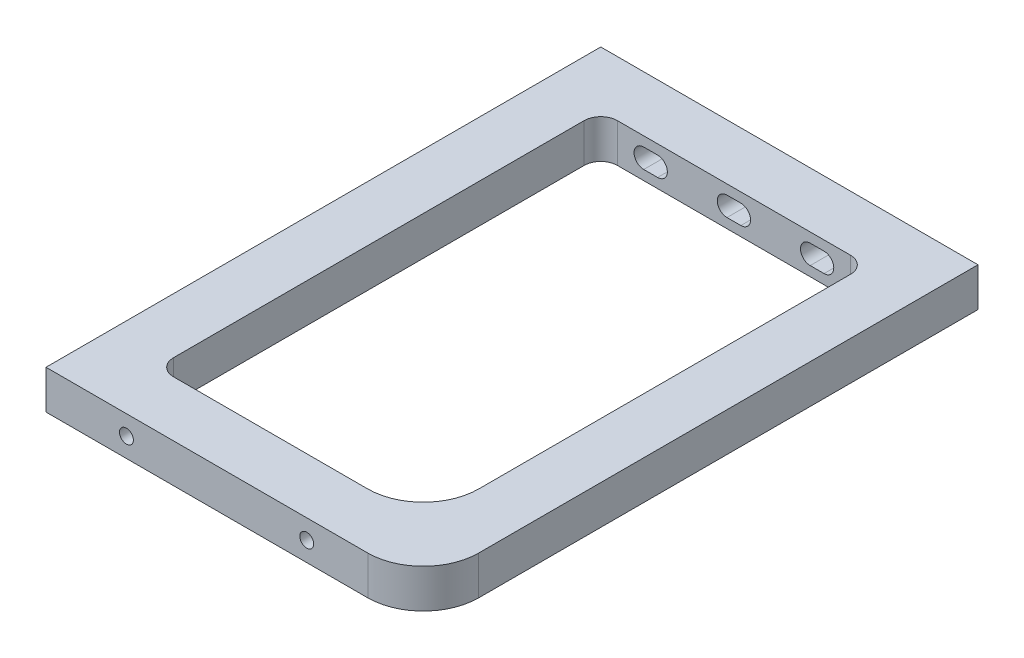
from build123d import *

# Parameters (mm, degrees)
BOSS_EXTRUDE1_DEPTH       = 200
CUT_EXTRUDE1_DEPTH        = 250.198715888
F_6_0MM_DOWEL_SLOT1_DEPTH = 20
M6X1_0_TAPPED_HOLE1_D     = 5
M6X1_0_TAPPED_HOLE1_DEPTH = 21.497848452
M6X1_0_TAPPED_HOLE1_TIP   = 1.502151548
FILLET1_R                 = 6
FILLET2_R                 = 20


# Read off the part's stored shape, not the designer's step: Ø6.0mm Dowel Slot1
with BuildPart() as part:
    # Sketch1 → Boss-Extrude1 (new body)
    with BuildSketch(Plane.XY):
        Polygon((-21, 207), (-148, 207), (-148, 197.5), (-148, 193), (-24, 193), (-12, 193), (-12, 207), align=None)
    extrude(amount=BOSS_EXTRUDE1_DEPTH)

    # Sketch3 → Cut-Extrude1 (cut, through all)
    with BuildSketch(Plane(origin=(0, 207, 0), x_dir=(1, 0, 0), z_dir=(0, 1, 0))):
        Polygon((-128, -20), (-128, -30), (-128, -108), (-128, -180), (-118, -180), (-54, -180), (-32, -180), (-32, -20), align=None)
    extrude(amount=-CUT_EXTRUDE1_DEPTH, mode=Mode.SUBTRACT)

    # Ø6.0mm Dowel Slot1 outline → Ø6.0mm Dowel Slot1 (cut)
    with BuildSketch(Plane.XY):
        with BuildLine():
            Line((-52.5, 196.5), (-47.5, 196.5))
            ThreePointArc((-47.5, 196.5), (-44, 200), (-47.5, 203.5))
            Line((-47.5, 203.5), (-52.5, 203.5))
            ThreePointArc((-52.5, 203.5), (-56, 200), (-52.5, 196.5))
        make_face()
        with BuildLine():
            ThreePointArc((-77.5, 196.5), (-74, 200), (-77.5, 203.5))
            Line((-77.5, 203.5), (-82.5, 203.5))
            ThreePointArc((-82.5, 203.5), (-86, 200), (-82.5, 196.5))
            Line((-82.5, 196.5), (-77.5, 196.5))
        make_face()
        with BuildLine():
            ThreePointArc((-107.5, 196.5), (-104, 200), (-107.5, 203.5))
            Line((-107.5, 203.5), (-112.5, 203.5))
            ThreePointArc((-112.5, 203.5), (-116, 200), (-112.5, 196.5))
            Line((-112.5, 196.5), (-107.5, 196.5))
        make_face()
    extrude(amount=F_6_0MM_DOWEL_SLOT1_DEPTH, mode=Mode.SUBTRACT)

    # M6x1.0 Tapped Hole1
    with Locations(Plane.XY.offset(200)):
        with Locations((-119, 200), (-54, 200)):
            Hole(M6X1_0_TAPPED_HOLE1_D / 2, depth=M6X1_0_TAPPED_HOLE1_DEPTH)
            with Locations((0, 0, -(M6X1_0_TAPPED_HOLE1_DEPTH + M6X1_0_TAPPED_HOLE1_TIP / 2))):  # 118° drill point
                Cone(0, M6X1_0_TAPPED_HOLE1_D / 2, M6X1_0_TAPPED_HOLE1_TIP, mode=Mode.SUBTRACT)

    # Fillet1
    fillet1_edges = [part.edges().sort_by_distance(p)[0] for p in [
        (-128, 200, 180),
        (-128, 200, 20),
        (-32, 200, 20),
    ]]
    fillet(fillet1_edges, radius=FILLET1_R)

    # Fillet2
    fillet2_edges = [part.edges().sort_by_distance(p)[0] for p in [
        (-12, 200, 200),
        (-32, 200, 180),
    ]]
    fillet(fillet2_edges, radius=FILLET2_R)


solid = part.part
